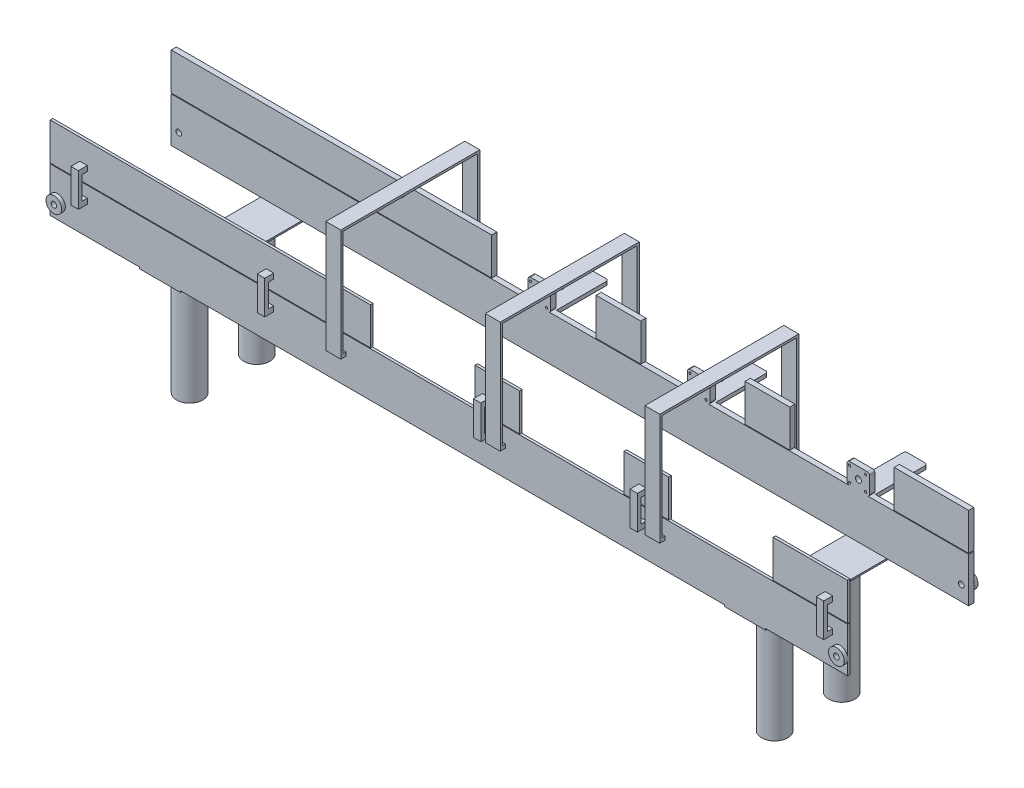
from build123d import *

# Parameters (mm, degrees)
SKETCH1_W               = 1070
SKETCH1_H               = 60
BOSS_EXTRUDE1_DEPTH     = 3.5
BOSS_EXTRUDE2_START     = 1
SKETCH2_W               = 1070
SKETCH2_H               = 3.5
BOSS_EXTRUDE2_DEPTH     = 50
SKETCH3_W               = 140
SKETCH3_H               = 50
CUT_EXTRUDE1_DEPTH      = 50
LPATTERN2_COUNT         = 3
LPATTERN2_PITCH         = 200
SKETCH5_W               = 10
SKETCH5_H               = 7
BOSS_EXTRUDE3_DEPTH     = 7
SKETCH6_W               = 10
SKETCH6_H               = 45
BOSS_EXTRUDE4_DEPTH     = 5
LPATTERN3_START         = 10.5
LPATTERN3_OUTLINE_W     = 10
LPATTERN3_OUTLINE_H     = 45
LPATTERN3_DEPTH         = 5
LPATTERN3_START_2       = 3.5
LPATTERN3_2_OUTLINE_W   = 10
LPATTERN3_2_OUTLINE_H   = 7
LPATTERN3_2_DEPTH       = 7
SKETCH7_W               = 10
SKETCH7_H               = 7
BOSS_EXTRUDE5_DEPTH     = 7
LPATTERN4_COUNT         = 2
LPATTERN4_PITCH         = 460
SKETCH8_W               = 430
SKETCH8_H               = 50
BOSS_EXTRUDE6_DEPTH     = 7
SKETCH8_W_2             = 60
BOSS_EXTRUDE6_2_DEPTH   = 7
BOSS_EXTRUDE6_3_DEPTH   = 7
SKETCH8_W_3             = 100
BOSS_EXTRUDE6_4_DEPTH   = 7
SKETCH8_W_4             = 1070
SKETCH8_H_2             = 60
BOSS_EXTRUDE6_5_DEPTH   = 7
SKETCH9_W               = 10
SKETCH9_H               = 7
BOSS_EXTRUDE7_DEPTH     = 7
BOSS_EXTRUDE8_START     = 7
SKETCH9_3_W             = 10
SKETCH9_3_H             = 16
SKETCH9_3_H_2           = 15
BOSS_EXTRUDE8_DEPTH     = 5
LPATTERN5_COUNT         = 2
LPATTERN5_PITCH         = 450
LPATTERN6_COUNT         = 5
LPATTERN6_PITCH         = 250
SKETCH10_R              = 3.75
CUT_EXTRUDE2_DEPTH      = 570.1557344
LPATTERN7_COUNT         = 2
LPATTERN7_PITCH         = 1050
SKETCH11_W              = 20
SKETCH11_H              = 5
BOSS_EXTRUDE9_DEPTH     = 7
BOSS_EXTRUDE10_START    = -7
SKETCH12_W              = 20
SKETCH12_H              = 5
BOSS_EXTRUDE10_DEPTH    = 7
BOSS_EXTRUDE11_DEPTH    = 20
SKETCH14_W              = 5
SKETCH14_H              = 20
BOSS_EXTRUDE12_DEPTH    = 7
SKETCH15_W              = 1
SKETCH15_H              = 3
BOSS_EXTRUDE13_DEPTH    = 3
LPATTERN13_COUNT        = 3
LPATTERN13_PITCH        = 214
SKETCH16_W              = 55
SKETCH16_H              = 169.5
BOSS_EXTRUDE14_DEPTH    = 2
SKETCH17_R              = 17.5
BOSS_EXTRUDE15_DEPTH    = 150
FILLET1_R               = 5
SKETCH21_W              = 30
SKETCH21_H              = 70
BOSS_EXTRUDE17_DEPTH    = 5
SKETCH28_R              = 4
SKETCH28_R_2            = 1.5
BOSS_EXTRUDE20_DEPTH    = 7
FILLET2_R               = 3
LPATTERN17_COUNT        = 2
LPATTERN17_PITCH        = 214
FILLET2_OF_LPATTERN17_R = 3
LPATTERN18_COUNT        = 2
LPATTERN18_PITCH        = 214
FILLET2_OF_LPATTERN18_R = 3
SKETCH29_R              = 10.5
SKETCH29_R_2            = 3.75
BOSS_EXTRUDE21_DEPTH    = 5
BOSS_EXTRUDE22_START    = 5
SKETCH30_R              = 10.5
SKETCH30_R_2            = 3.75
BOSS_EXTRUDE22_DEPTH    = 5
BOSS_EXTRUDE23_START    = 5
SKETCH31_R              = 10.5
SKETCH31_R_2            = 3.75
BOSS_EXTRUDE23_DEPTH    = 5
SKETCH32_R              = 10.5
SKETCH32_R_2            = 3.75
BOSS_EXTRUDE24_DEPTH    = 5


# Read off the part's stored shape, not the designer's step: LPattern3
with BuildPart() as part:
    # Sketch1 → Boss-Extrude1 (new body)
    with BuildSketch(Plane.XY):
        Rectangle(SKETCH1_W, SKETCH1_H)
    extrude(amount=BOSS_EXTRUDE1_DEPTH)



with BuildPart() as body_2:
    # Sketch2 → Boss-Extrude2 (new body)
    with BuildSketch(Plane(origin=(0, 30, 0), x_dir=(1, 0, 0), z_dir=(0, 1, 0)).offset(BOSS_EXTRUDE2_START)):
        with Locations((0, -1.75)):
            Rectangle(SKETCH2_W, SKETCH2_H)
    extrude(amount=BOSS_EXTRUDE2_DEPTH)

    # Sketch3 → Cut-Extrude1 (cut)
    with BuildSketch(Plane.XY.offset(3.5)):
        with Locations((365, 56)):
            Rectangle(SKETCH3_W, SKETCH3_H)
    cut_extrude1 = extrude(amount=-CUT_EXTRUDE1_DEPTH, mode=Mode.SUBTRACT)


with BuildPart() as cut_extrude1_piece_1:
    # of the separate pieces the step leaves, piece 1, a body of its own (cut_extrude1_pieces)
    add(body_2.part.solids().sort_by_distance((295, 31, 0))[0])

    # LPattern2: Cut-Extrude1 ×3
    with Locations(*[(-i * LPATTERN2_PITCH, 0, 0) for i in range(1, LPATTERN2_COUNT)]):
        add(cut_extrude1, mode=Mode.SUBTRACT)


with BuildPart() as cut_extrude1_piece_2:
    # of the separate pieces the step leaves, piece 2, a body of its own (cut_extrude1_pieces)
    add(body_2.part.solids().sort_by_distance((535, 31, 0))[0])


with BuildPart() as part_1:
    add(part.part)

    add(cut_extrude1_piece_2.part)  # Boss-Extrude3 merges Cut-Extrude1 piece 2
    # Sketch5 → Boss-Extrude3 (add)
    with BuildSketch(Plane.XY.offset(3.5)):
        with Locations((510, 49.5)):
            Rectangle(SKETCH5_W, SKETCH5_H)
        with Locations((510, 11.5)):
            Rectangle(SKETCH5_W, SKETCH5_H)
    boss_extrude3 = extrude(amount=BOSS_EXTRUDE3_DEPTH)

    # Sketch6 → Boss-Extrude4 (add)
    with BuildSketch(Plane.XY.offset(10.5)):
        with Locations((510, 30.5)):
            Rectangle(SKETCH6_W, SKETCH6_H)
    boss_extrude4 = extrude(amount=BOSS_EXTRUDE4_DEPTH)


    add(cut_extrude1_piece_1.part)  # LPattern3 2 merges Cut-Extrude1 piece 1


with BuildPart() as body_3:
    # LPattern3 outline → LPattern3 (new body)
    with BuildSketch(Plane.XY.offset(LPATTERN3_START)):
        with Locations((-240, 30.5)):
            Rectangle(LPATTERN3_OUTLINE_W, LPATTERN3_OUTLINE_H)
        with Locations((-490, 30.5)):
            Rectangle(LPATTERN3_OUTLINE_W, LPATTERN3_OUTLINE_H)
        with Locations((260, 30.5)):
            Rectangle(LPATTERN3_OUTLINE_W, LPATTERN3_OUTLINE_H)
    extrude(amount=LPATTERN3_DEPTH)


with BuildPart() as part_2:
    add(part_1.part)

    add(body_3.part)  # LPattern3 2 merges body 3
    # LPattern3 2 outline → LPattern3 2 (add)
    with BuildSketch(Plane.XY.offset(LPATTERN3_START_2)):
        with Locations((-240, 11.5)):
            Rectangle(LPATTERN3_2_OUTLINE_W, LPATTERN3_2_OUTLINE_H)
        with Locations((-240, 49.5)):
            Rectangle(LPATTERN3_2_OUTLINE_W, LPATTERN3_2_OUTLINE_H)
        with Locations((-490, 49.5)):
            Rectangle(LPATTERN3_2_OUTLINE_W, LPATTERN3_2_OUTLINE_H)
        with Locations((-490, 11.5)):
            Rectangle(LPATTERN3_2_OUTLINE_W, LPATTERN3_2_OUTLINE_H)
        with Locations((260, 11.5)):
            Rectangle(LPATTERN3_2_OUTLINE_W, LPATTERN3_2_OUTLINE_H)
    extrude(amount=LPATTERN3_2_DEPTH)

    # Sketch7 → Boss-Extrude5 (add)
    with BuildSketch(Plane.XY.offset(3.5)):
        with Locations((260, 49.5)):
            Rectangle(SKETCH7_W, SKETCH7_H)
    extrude(amount=BOSS_EXTRUDE5_DEPTH)

    # LPattern4: Boss-Extrude3, Boss-Extrude4 ×2
    with Locations(*[(-i * LPATTERN4_PITCH, 0, 0) for i in range(1, LPATTERN4_COUNT)]):
        add(boss_extrude3)
        add(boss_extrude4)


with BuildPart() as body_2_2:
    # Sketch8 → Boss-Extrude6 (new body)
    with BuildSketch(Plane.XY.offset(-159)):
        with Locations((-320, 56)):
            Rectangle(SKETCH8_W, SKETCH8_H)
    extrude(amount=-BOSS_EXTRUDE6_DEPTH)


with BuildPart() as body_3_2:
    # Sketch8 → Boss-Extrude6 2 (new body)
    with BuildSketch(Plane.XY.offset(-159)):
        with Locations((65, 56)):
            Rectangle(SKETCH8_W_2, SKETCH8_H)
    extrude(amount=-BOSS_EXTRUDE6_2_DEPTH)


with BuildPart() as body_4:
    # Sketch8 → Boss-Extrude6 3 (new body)
    with BuildSketch(Plane.XY.offset(-159)):
        with Locations((265, 56)):
            Rectangle(SKETCH8_W_2, SKETCH8_H)
    extrude(amount=-BOSS_EXTRUDE6_3_DEPTH)


with BuildPart() as body_5:
    # Sketch8 → Boss-Extrude6 4 (new body)
    with BuildSketch(Plane.XY.offset(-159)):
        with Locations((485, 56)):
            Rectangle(SKETCH8_W_3, SKETCH8_H)
    extrude(amount=-BOSS_EXTRUDE6_4_DEPTH)



with BuildPart() as body_6:
    # Sketch8 → Boss-Extrude6 5 (new body)
    with BuildSketch(Plane.XY.offset(-159)):
        Rectangle(SKETCH8_W_4, SKETCH8_H_2)
    extrude(amount=-BOSS_EXTRUDE6_5_DEPTH)


with BuildPart() as body_5_1:
    add(body_5.part)

    add(body_6.part)  # Boss-Extrude7 merges body 6
    # Sketch9 → Boss-Extrude7 (add)
    with BuildSketch(Plane(origin=(0, 0, -166), x_dir=(-1, 0, 0), z_dir=(0, 0, -1))):
        with Locations((-510, 49.5)):
            Rectangle(SKETCH9_W, SKETCH9_H)
        with Locations((-510, 11.5)):
            Rectangle(SKETCH9_W, SKETCH9_H)
    boss_extrude7 = extrude(amount=BOSS_EXTRUDE7_DEPTH)

    # Sketch9<3> → Boss-Extrude8 (add)
    with BuildSketch(Plane(origin=(0, 0, -166), x_dir=(-1, 0, 0), z_dir=(0, 0, -1)).offset(BOSS_EXTRUDE8_START)):
        with Locations((-510, 38)):
            Rectangle(SKETCH9_3_W, SKETCH9_3_H)
        with Locations((-510, 22.5)):
            Rectangle(SKETCH9_3_W, SKETCH9_3_H_2)
    boss_extrude8 = extrude(amount=-BOSS_EXTRUDE8_DEPTH)


with BuildPart() as body_3_2_1:
    add(body_3_2.part)

    add(body_5_1.part)  # LPattern5 merges body 5
    # LPattern5: Boss-Extrude7, Boss-Extrude8 ×2
    with Locations(*[(-i * LPATTERN5_PITCH, 0, 0) for i in range(1, LPATTERN5_COUNT)]):
        add(boss_extrude7)
        add(boss_extrude8)


with BuildPart() as body_2_2_1:
    add(body_2_2.part)

    add(body_3_2_1.part)  # LPattern6 merges body 3 2

    add(body_4.part)  # LPattern6 merges body 4
    # LPattern6: Boss-Extrude7, Boss-Extrude8 ×5, 1 skipped
    with Locations(*[(-i * LPATTERN6_PITCH, 0, 0) for i in range(1, LPATTERN6_COUNT) if i not in (2,)]):
        add(boss_extrude7)
        add(boss_extrude8)


with BuildPart() as cut_extrude2_tool:
    # Sketch10 → Cut-Extrude2 (new, symmetric)
    with BuildSketch(Plane.XY.offset(3.5)):
        with Locations((525, -10)):
            Circle(SKETCH10_R)
    cut_extrude2 = extrude(amount=CUT_EXTRUDE2_DEPTH, both=True)


with BuildPart() as part_3:
    add(part_2.part)

    # Cut-Extrude2: cut by cut_extrude2_tool
    add(cut_extrude2_tool.part, mode=Mode.SUBTRACT)


with BuildPart() as body_2_2_2:
    add(body_2_2_1.part)

    # Cut-Extrude2: cut by cut_extrude2_tool
    add(cut_extrude2_tool.part, mode=Mode.SUBTRACT)


with BuildPart() as lpattern7_tool:
    # LPattern7: Cut-Extrude2 ×2
    with Locations(*[(-i * LPATTERN7_PITCH, 0, 0) for i in range(1, LPATTERN7_COUNT)]):
        add(cut_extrude2)


with BuildPart() as part_4:
    add(part_3.part)

    # LPattern7: cut by lpattern7_tool
    add(lpattern7_tool.part, mode=Mode.SUBTRACT)

    # Sketch11 → Boss-Extrude9 (add)
    with BuildSketch(Plane.XY.offset(3.5)):
        with Locations((280, 7.5)):
            Rectangle(SKETCH11_W, SKETCH11_H)
    boss_extrude9 = extrude(amount=BOSS_EXTRUDE9_DEPTH)



with BuildPart() as body_2_2_3:
    add(body_2_2_2.part)

    # LPattern7: cut by lpattern7_tool
    add(lpattern7_tool.part, mode=Mode.SUBTRACT)

    # Sketch12 → Boss-Extrude10 (add)
    with BuildSketch(Plane.XY.offset(-159).offset(BOSS_EXTRUDE10_START)):
        with Locations((280, 7.5)):
            Rectangle(SKETCH12_W, SKETCH12_H)
    boss_extrude10 = extrude(amount=-BOSS_EXTRUDE10_DEPTH)


with BuildPart() as part_5:
    add(part_4.part)

    add(body_2_2_3.part)  # Boss-Extrude11 merges body 2 2
    # Sketch13 → Boss-Extrude11 (add)
    with BuildSketch(Plane(origin=(290, 0, 0), x_dir=(0, 0, -1), z_dir=(1, 0, 0))):
        Polygon((-10.5, 90.885599237), (-10.5, 10), (-7.5, 10), (-7.5, 152), (173, 152), (173, 5), (176, 5), (176, 90.660123489), (176, 155), (-5.5, 155), (-10.5, 155), align=None)
    boss_extrude11 = extrude(amount=-BOSS_EXTRUDE11_DEPTH)

    # Sketch14 → Boss-Extrude12 (add)
    with BuildSketch(Plane.XZ.offset(-152)):
        with Locations((280, -82.75)):
            Rectangle(SKETCH14_W, SKETCH14_H)
    boss_extrude12 = extrude(amount=BOSS_EXTRUDE12_DEPTH)

    # Sketch15 → Boss-Extrude13 (add)
    with BuildSketch(Plane.XZ.offset(-145)):
        with Locations((280, -82.75)):
            Rectangle(SKETCH15_W, SKETCH15_H)
    boss_extrude13 = extrude(amount=BOSS_EXTRUDE13_DEPTH)

    # LPattern13: Boss-Extrude9, Boss-Extrude10, Boss-Extrude11, Boss-Extrude12, Boss-Extrude13 ×3
    with Locations(*[(-i * LPATTERN13_PITCH, 0, 0) for i in range(1, LPATTERN13_COUNT)]):
        add(boss_extrude9)
        add(boss_extrude10)
        add(boss_extrude11)
        add(boss_extrude12)
        add(boss_extrude13)

    # Sketch16 → Boss-Extrude14 (add)
    with BuildSketch(Plane.XZ.offset(30)):
        with Locations((-387.5, -81.25)):
            Rectangle(SKETCH16_W, SKETCH16_H)
        with Locations((397.5, -81.25)):
            Rectangle(SKETCH16_W, SKETCH16_H)
    extrude(amount=BOSS_EXTRUDE14_DEPTH)

    # Sketch17 → Boss-Extrude15 (add)
    with BuildSketch(Plane.XZ.offset(32)):
        with Locations(Location((397.5, -36.25, 0), (0, 0, 270))):
            Circle(SKETCH17_R)
        with Locations(Location((397.5, -126.25, 0), (0, 0, 270))):
            Circle(SKETCH17_R)
        with Locations(Location((-387.5, -36.25, 0), (0, 0, 270))):
            Circle(SKETCH17_R)
        with Locations(Location((-387.5, -126.25, 0), (0, 0, 270))):
            Circle(SKETCH17_R)
    extrude(amount=BOSS_EXTRUDE15_DEPTH)

    # Fillet1
    fillet1_edges = [part_5.edges().sort_by_distance(p)[0] for p in [
        (397.5, -32, -18.75),
        (397.5, -32, -108.75),
        (-387.5, -32, -18.75),
        (-387.5, -32, -108.75),
    ]]
    fillet(fillet1_edges, radius=FILLET1_R)

    # Sketch21 → Boss-Extrude17 (add)
    with BuildSketch(Plane(origin=(0, 30, 0), x_dir=(1, 0, 0), z_dir=(0, 1, 0))):
        with Locations((173.804503039, 201)):
            Rectangle(SKETCH21_W, SKETCH21_H)
    boss_extrude17 = extrude(amount=-BOSS_EXTRUDE17_DEPTH)

    # Sketch28 → Boss-Extrude20 (add)
    with BuildSketch(Plane(origin=(0, 0, -166), x_dir=(-1, 0, 0), z_dir=(0, 0, -1))):
        with BuildLine():
            Line((-185, 58), (-161, 58))
            ThreePointArc((-161, 58), (-158.878679656, 57.121320344), (-158, 55))
            Line((-158, 55), (-158, 33))
            ThreePointArc((-158, 33), (-158.878679656, 30.878679656), (-161, 30))
            Line((-161, 30), (-185, 30))
            ThreePointArc((-185, 30), (-187.121320344, 30.878679656), (-188, 33))
            Line((-188, 33), (-188, 55))
            ThreePointArc((-188, 55), (-187.121320344, 57.121320344), (-185, 58))
        make_face()
        with Locations((-173, 43)):
            Circle(SKETCH28_R, mode=Mode.SUBTRACT)
        with Locations((-182.693915618, 53.39)):
            Circle(SKETCH28_R_2, mode=Mode.SUBTRACT)
        with Locations((-161.168915618, 53.39)):
            Circle(SKETCH28_R_2, mode=Mode.SUBTRACT)
        with Locations((-161.168915618, 33.3)):
            Circle(SKETCH28_R_2, mode=Mode.SUBTRACT)
        with Locations((-182.693915618, 33.3)):
            Circle(SKETCH28_R_2, mode=Mode.SUBTRACT)
    boss_extrude20 = extrude(amount=-BOSS_EXTRUDE20_DEPTH)

    # Fillet2
    fillet2_edges = [part_5.edges().sort_by_distance(p)[0] for p in [
        (158.804503039, 27.5, -236),
        (188.804503039, 27.5, -236),
    ]]
    fillet(fillet2_edges, radius=FILLET2_R)

    # LPattern17: Boss-Extrude17, Boss-Extrude20 ×2
    with Locations(*[(i * LPATTERN17_PITCH, 0, 0) for i in range(1, LPATTERN17_COUNT)]):
        add(boss_extrude17)
        add(boss_extrude20)

    # Fillet2 of LPattern17
    fillet2_of_lpattern17_edges = [part_5.edges().sort_by_distance(p)[0] for p in [
        (372.804503039, 27.5, -236),
        (402.804503039, 27.5, -236),
    ]]
    fillet(fillet2_of_lpattern17_edges, radius=FILLET2_OF_LPATTERN17_R)

    # LPattern18: Boss-Extrude17, Boss-Extrude20 ×2
    with Locations(*[(-i * LPATTERN18_PITCH, 0, 0) for i in range(1, LPATTERN18_COUNT)]):
        add(boss_extrude17)
        add(boss_extrude20)

    # Fillet2 of LPattern18
    fillet2_of_lpattern18_edges = [part_5.edges().sort_by_distance(p)[0] for p in [
        (-55.195496961, 27.5, -236),
        (-25.195496961, 27.5, -236),
    ]]
    fillet(fillet2_of_lpattern18_edges, radius=FILLET2_OF_LPATTERN18_R)

    # Sketch29 → Boss-Extrude21 (add)
    with BuildSketch(Plane(origin=(0, 0, -166), x_dir=(-1, 0, 0), z_dir=(0, 0, -1))):
        with Locations(Location((-525, -10, 0), (0, 0, 197.752790162))):
            Circle(SKETCH29_R)
        with Locations(Location((-525, -10, 0), (0, 0, 180))):
            Circle(SKETCH29_R_2, mode=Mode.SUBTRACT)
    extrude(amount=BOSS_EXTRUDE21_DEPTH)

    # Sketch30 → Boss-Extrude22 (add)
    with BuildSketch(Plane.XY.offset(3.5).offset(BOSS_EXTRUDE22_START)):
        with Locations(Location((525, -10, 0), (0, 0, 342.247209838))):
            Circle(SKETCH30_R)
        with Locations((525, -10)):
            Circle(SKETCH30_R_2, mode=Mode.SUBTRACT)
    extrude(amount=-BOSS_EXTRUDE22_DEPTH)

    # Sketch31 → Boss-Extrude23 (add)
    with BuildSketch(Plane.XY.offset(3.5).offset(BOSS_EXTRUDE23_START)):
        with Locations(Location((-525, -10, 0), (0, 0, 197.752790162))):
            Circle(SKETCH31_R)
        with Locations((-525, -10)):
            Circle(SKETCH31_R_2, mode=Mode.SUBTRACT)
    extrude(amount=-BOSS_EXTRUDE23_DEPTH)

    # Sketch32 → Boss-Extrude24 (add)
    with BuildSketch(Plane(origin=(0, 0, -166), x_dir=(-1, 0, 0), z_dir=(0, 0, -1))):
        with Locations(Location((525, -10, 0), (0, 0, 342.247209838))):
            Circle(SKETCH32_R)
        with Locations(Location((525, -10, 0), (0, 0, 180))):
            Circle(SKETCH32_R_2, mode=Mode.SUBTRACT)
    extrude(amount=BOSS_EXTRUDE24_DEPTH)


solid = part_5.part
